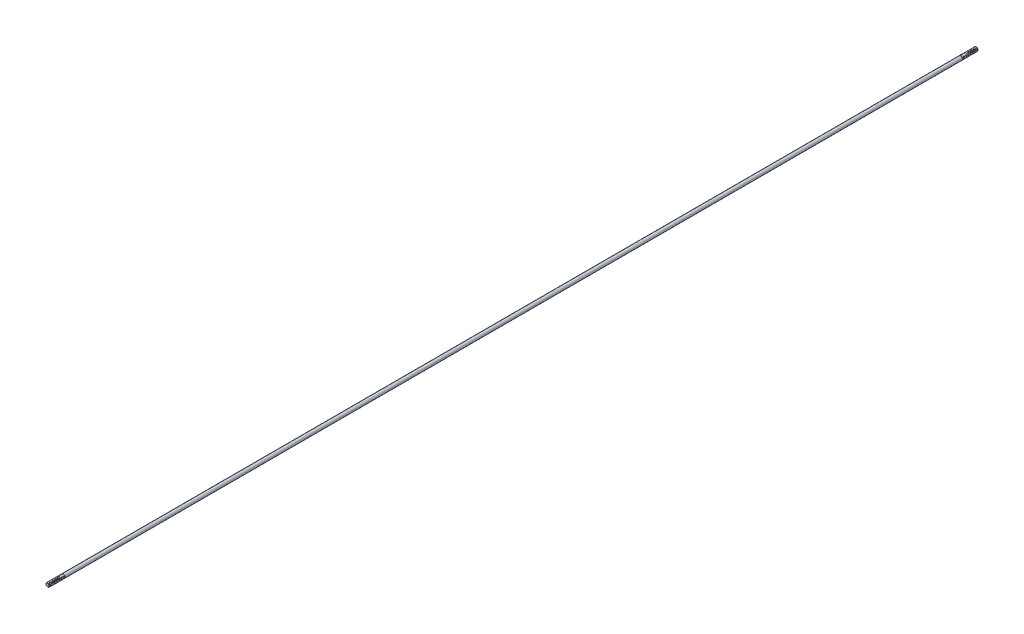
from build123d import *

# Parameters (mm, degrees)
SKETCH1_R           = 4.7625
BOSS_EXTRUDE1_DEPTH = 1140
CHAMFER1_SIZE       = 1
THREAD1_PITCH       = 1.5875
THREAD2_PITCH       = 1.5875


with BuildPart() as part:
    # Sketch1 → Boss-Extrude1 (new, symmetric)
    with BuildSketch(Plane.XY):
        Circle(SKETCH1_R)
    extrude(amount=BOSS_EXTRUDE1_DEPTH, both=True)

    # Chamfer1
    chamfer1_edges = [part.edges().sort_by_distance(p)[0] for p in [
        (-4.7625, 0, -1140),
        (-4.7625, 0, 1140),
    ]]
    chamfer(chamfer1_edges, length=CHAMFER1_SIZE)

    # Thread1: the profile of Thread Profile1 profile screwed along a right-hand helix of 25.19685 turns, 8 arcs to a turn; built about Z, then put on its axis
    thread1_z = Axis((0, 0, 0), (0, 0, 1))
    thread1_corners = [(4.7628, 0, -0.000173205), (4.7628, 0, 1.389235701), (3.903240423, 0, 0.892968748), (3.903240423, 0, 0.496093748)]
    with BuildLine(mode=Mode.PRIVATE) as thread1_profile:
        Line(thread1_corners[0], thread1_corners[1])
        Line(thread1_corners[1], thread1_corners[2])
        Line(thread1_corners[2], thread1_corners[3])
        Line(thread1_corners[3], thread1_corners[0])
    thread1_cap = Face(thread1_profile.wire())
    thread1_turn_angles = [0, 22.5, 45, 67.5, 90, 112.5, 135, 157.5, 180, 202.5, 225, 247.5, 270, 292.5, 315, 337.5, 360]
    thread1_turn_weights = [1, 0.9238795325112867, 1, 0.9238795325112867, 1, 0.9238795325112867, 1, 0.9238795325112867, 1, 0.9238795325112867, 1, 0.9238795325112867, 1, 0.9238795325112867, 1, 0.9238795325112867, 1]
    thread1_turn_rails = [Edge.make_bspline([Vector(p[0], p[1], 0).rotate(thread1_z, thread1_turn_angles[k]) / thread1_turn_weights[k] + Vector(0, 0, p[2] + THREAD1_PITCH * thread1_turn_angles[k] / 360) for k in range(17)], [0, 0, 0, 1, 1, 2, 2, 3, 3, 4, 4, 5, 5, 6, 6, 7, 7, 8, 8, 8], 2, thread1_turn_weights) for p in thread1_corners]
    thread1_turn_sides = [Face.make_surface_from_curves(thread1_turn_rails[p[0]], thread1_turn_rails[p[1]]) for p in [(0, 1), (1, 2), (2, 3), (3, 0)]]
    thread1_last_angles = [9000, 9022.5, 9045, 9057.933070866, 9070.866141732]
    thread1_last_weights = [1, 0.9238795325112867, 1, 0.9746321728627872, 1]
    thread1_last_rails = [Edge.make_bspline([Vector(p[0], p[1], 0).rotate(thread1_z, thread1_last_angles[k]) / thread1_last_weights[k] + Vector(0, 0, p[2] + THREAD1_PITCH * thread1_last_angles[k] / 360) for k in range(5)], [0, 0, 0, 1, 1, 2, 2, 2], 2, thread1_last_weights) for p in thread1_corners]
    thread1_last_sides = [Face.make_surface_from_curves(thread1_last_rails[p[0]], thread1_last_rails[p[1]]) for p in [(0, 1), (1, 2), (2, 3), (3, 0)]]
    thread1 = Plane(origin=(0, 0, 1142), x_dir=(-1, 0, 0), z_dir=(0, 0, -1)) * Solid(Shell([*[p.moved(Location((0, 0, THREAD1_PITCH * i))) for i in range(25) for p in thread1_turn_sides], *thread1_last_sides, thread1_cap, thread1_cap.rotate(thread1_z, 9070.866141732).moved(Location((0, 0, THREAD1_PITCH * 9070.866141732 / 360)))]))
    add(thread1, mode=Mode.SUBTRACT)

    # Thread2: the profile of Thread Profile2 profile screwed along a right-hand helix of 25.19685 turns, 8 arcs to a turn; built about Z, then put on its axis
    thread2_z = Axis((0, 0, 0), (0, 0, 1))
    thread2_corners = [(4.7628, 0, -0.000173205), (4.7628, 0, 1.389235701), (3.903240423, 0, 0.892968748), (3.903240423, 0, 0.496093748)]
    with BuildLine(mode=Mode.PRIVATE) as thread2_profile:
        Line(thread2_corners[0], thread2_corners[1])
        Line(thread2_corners[1], thread2_corners[2])
        Line(thread2_corners[2], thread2_corners[3])
        Line(thread2_corners[3], thread2_corners[0])
    thread2_cap = Face(thread2_profile.wire())
    thread2_turn_angles = [0, 22.5, 45, 67.5, 90, 112.5, 135, 157.5, 180, 202.5, 225, 247.5, 270, 292.5, 315, 337.5, 360]
    thread2_turn_weights = [1, 0.9238795325112867, 1, 0.9238795325112867, 1, 0.9238795325112867, 1, 0.9238795325112867, 1, 0.9238795325112867, 1, 0.9238795325112867, 1, 0.9238795325112867, 1, 0.9238795325112867, 1]
    thread2_turn_rails = [Edge.make_bspline([Vector(p[0], p[1], 0).rotate(thread2_z, thread2_turn_angles[k]) / thread2_turn_weights[k] + Vector(0, 0, p[2] + THREAD2_PITCH * thread2_turn_angles[k] / 360) for k in range(17)], [0, 0, 0, 1, 1, 2, 2, 3, 3, 4, 4, 5, 5, 6, 6, 7, 7, 8, 8, 8], 2, thread2_turn_weights) for p in thread2_corners]
    thread2_turn_sides = [Face.make_surface_from_curves(thread2_turn_rails[p[0]], thread2_turn_rails[p[1]]) for p in [(0, 1), (1, 2), (2, 3), (3, 0)]]
    thread2_last_angles = [9000, 9022.5, 9045, 9057.933070866, 9070.866141732]
    thread2_last_weights = [1, 0.9238795325112867, 1, 0.9746321728627872, 1]
    thread2_last_rails = [Edge.make_bspline([Vector(p[0], p[1], 0).rotate(thread2_z, thread2_last_angles[k]) / thread2_last_weights[k] + Vector(0, 0, p[2] + THREAD2_PITCH * thread2_last_angles[k] / 360) for k in range(5)], [0, 0, 0, 1, 1, 2, 2, 2], 2, thread2_last_weights) for p in thread2_corners]
    thread2_last_sides = [Face.make_surface_from_curves(thread2_last_rails[p[0]], thread2_last_rails[p[1]]) for p in [(0, 1), (1, 2), (2, 3), (3, 0)]]
    thread2 = Plane(origin=(0, 0, -1142), x_dir=(1, 0, 0), z_dir=(0, 0, 1)) * Solid(Shell([*[p.moved(Location((0, 0, THREAD2_PITCH * i))) for i in range(25) for p in thread2_turn_sides], *thread2_last_sides, thread2_cap, thread2_cap.rotate(thread2_z, 9070.866141732).moved(Location((0, 0, THREAD2_PITCH * 9070.866141732 / 360)))]))
    add(thread2, mode=Mode.SUBTRACT)


solid = part.part
